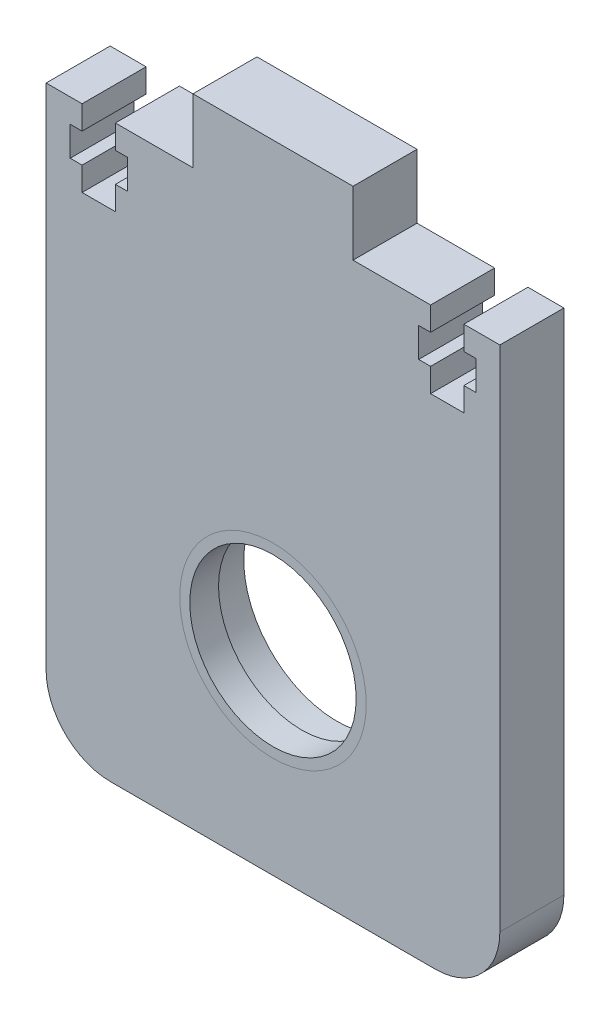
from build123d import *

# Parameters (mm, degrees)
SKETCH12_W           = 90
SKETCH12_H           = 113.63
BOSS_EXTRUDE10_DEPTH = 12.7
SKETCH25_R           = 18.5
CUT_EXTRUDE1_DEPTH   = 191.303286742
SKETCH26_R           = 18.5
SKETCH26_R_2         = 16.5
BOSS_EXTRUDE15_DEPTH = 5.7
FILLET1_R            = 12.8
CUT_EXTRUDE2_DEPTH   = 191.303286742
BOSS_EXTRUDE16_DEPTH = 12.7


with BuildPart() as part:
    # Sketch12 → Boss-Extrude10 (new body)
    with BuildSketch(Plane.XY):
        with Locations((107.125849364, 56.815)):
            Rectangle(SKETCH12_W, SKETCH12_H)
    extrude(amount=BOSS_EXTRUDE10_DEPTH)

    # Sketch25 → Cut-Extrude1 (cut, through all)
    with BuildSketch(Plane.XY.offset(12.7)):
        with Locations((107.125849364, 38.627603634)):
            Circle(SKETCH25_R)
    extrude(amount=-CUT_EXTRUDE1_DEPTH, mode=Mode.SUBTRACT)

    # Fillet1
    fillet1_edges = [part.edges().sort_by_distance(p)[0] for p in [
        (152.125849364, 0, 6.35),
        (62.125849364, 0, 6.35),
    ]]
    fillet(fillet1_edges, radius=FILLET1_R)

    # Sketch27 → Cut-Extrude2 (cut, through all)
    with BuildSketch(Plane(origin=(0, 0, 0), x_dir=(-1, 0, 0), z_dir=(0, 0, -1))):
        Polygon((-138.383849364, 108.931), (-138.383849364, 113.63), (-144.987849364, 113.63), (-144.987849364, 108.931), (-147.349849364, 108.931), (-147.349849364, 103.089), (-144.987849364, 103.089), (-144.987849364, 98.39), (-138.383849364, 98.39), (-138.383849364, 103.089), (-136.021849364, 103.089), (-136.021849364, 108.931), align=None)
        Polygon((-69.263849364, 108.931), (-69.263849364, 113.63), (-75.867849364, 113.63), (-75.867849364, 108.931), (-78.229849364, 108.931), (-78.229849364, 103.089), (-75.867849364, 103.089), (-75.867849364, 98.39), (-69.263849364, 98.39), (-69.263849364, 103.089), (-66.901849364, 103.089), (-66.901849364, 108.931), align=None)
    extrude(amount=-CUT_EXTRUDE2_DEPTH, mode=Mode.SUBTRACT)

    # Sketch28 → Boss-Extrude16 (add)
    with BuildSketch(Plane(origin=(0, 113.63, 0), x_dir=(1, 0, 0), z_dir=(0, 1, 0))):
        Polygon((107.125849364, 0), (91.250849364, 0), (91.250849364, -12.7), (123.000849364, -12.7), (123.000849364, 0), align=None)
    extrude(amount=BOSS_EXTRUDE16_DEPTH)


with BuildPart() as body_2:
    # Sketch26 → Boss-Extrude15 (new body)
    with BuildSketch(Plane.XY.offset(12.7)):
        with Locations((107.125849364, 38.627603634)):
            Circle(SKETCH26_R)
        with Locations((107.125849364, 38.627603634)):
            Circle(SKETCH26_R_2, mode=Mode.SUBTRACT)
    extrude(amount=-BOSS_EXTRUDE15_DEPTH)


solid = Compound([part.part, body_2.part])
